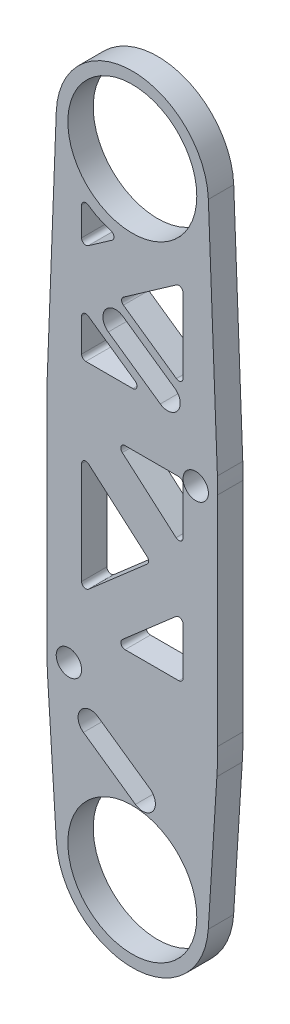
from build123d import *

# Parameters (mm, degrees)
SKETCH1_R               = 7.95
SKETCH1_R_2             = 3
MAIN_BODY_LINK_B1_DEPTH = 6
CUT_EXTRUDE2_REACH      = 169.025
CUT_EXTRUDE3_REACH      = 169.025
SKETCH5_R               = 1.5
PULLEYIDLERUP_DEPTH     = 6
CUT_EXTRUDE5_DEPTH      = 6
FILLET4_R               = 1
FILLET5_R               = 100
SKETCH8_R               = 15.25
CUT_EXTRUDE6_DEPTH      = 168.02546447


with BuildPart() as part:
    # Sketch1 → Main Body Link B1 (new body)
    with BuildSketch(Plane.XY):
        with BuildLine():
            Line((20.2, 41.674052381), (20.2, 83.474052381))
            Line((20.2, 83.474052381), (20.2, 90.874052381))
            Line((20.2, 90.874052381), (17.986683974, 148.383116621))
            ThreePointArc((17.986683974, 148.383116621), (0, 165.690874165), (-17.986683974, 148.383116621))
            Line((-17.986683974, 148.383116621), (-20.2, 90.874052381))
            Line((-20.2, 90.874052381), (-20.2, 83.474052381))
            Line((-20.2, 83.474052381), (-20.2, 41.674052381))
            Line((-20.2, 41.674052381), (-20.2, 34.274052381))
            Line((-20.2, 34.274052381), (-17.964224051, -1.134307826))
            ThreePointArc((-17.964224051, -1.134307826), (0, -18), (17.964224051, -1.134307826))
            Line((17.964224051, -1.134307826), (20.2, 34.274052381))
            Line((20.2, 34.274052381), (20.2, 41.674052381))
        make_face()
        Circle(SKETCH1_R, mode=Mode.SUBTRACT)
        with Locations((15, 88.174052381)):
            Circle(SKETCH1_R_2, mode=Mode.SUBTRACT)
        with Locations((-15, 37.024052381)):
            Circle(SKETCH1_R_2, mode=Mode.SUBTRACT)
        with Locations((0, 147.690874165)):
            Circle(SKETCH1_R, mode=Mode.SUBTRACT)
    extrude(amount=MAIN_BODY_LINK_B1_DEPTH)

    # Sketch4 → Cut-Extrude2 (cut, up to next)
    with BuildSketch(Plane.XY.offset(6), mode=Mode.PRIVATE) as cut_extrude2_sk1:
        with BuildLine():
            Line((-12, 134.2744663), (-12, 123.584968066))
            Line((-12, 123.584968066), (-2.929911079, 129.930929878))
            ThreePointArc((-2.929911079, 129.930929878), (-7.774454217, 131.456408925), (-12, 134.2744663))
        make_face()
    cut_extrude2_tool1 = extrude(cut_extrude2_sk1.sketch, amount=-CUT_EXTRUDE2_REACH, mode=Mode.PRIVATE) & part.part
    # Sketch4 → Cut-Extrude2 (cut, up to next)
    with BuildSketch(Plane.XY.offset(6), mode=Mode.PRIVATE) as cut_extrude2_sk2:
        Polygon((-12, 100.690874165), (3.278172542, 100.690874165), (-12, 111.380372399), align=None)
    cut_extrude2_tool2 = extrude(cut_extrude2_sk2.sketch, amount=-CUT_EXTRUDE2_REACH, mode=Mode.PRIVATE) & part.part
    # Sketch4 → Cut-Extrude2 (cut, up to next)
    with BuildSketch(Plane.XY.offset(6), mode=Mode.PRIVATE) as cut_extrude2_sk3:
        Polygon((12, 128.172168466), (12, 106.793171999), (-3.278172542, 117.482670232), align=None)
    cut_extrude2_tool3 = extrude(cut_extrude2_sk3.sketch, amount=-CUT_EXTRUDE2_REACH, mode=Mode.PRIVATE) & part.part
    # Sketch4 → Cut-Extrude2 (cut, up to next)
    with BuildSketch(Plane.XY.offset(6), mode=Mode.PRIVATE) as cut_extrude2_sk4:
        Polygon((-4.386441158, 88.090874165), (12, 88.090874165), (12, 73.82101499), align=None)
    cut_extrude2_tool4 = extrude(cut_extrude2_sk4.sketch, amount=-CUT_EXTRUDE2_REACH, mode=Mode.PRIVATE) & part.part
    # Sketch4 → Cut-Extrude2 (cut, up to next)
    with BuildSketch(Plane.XY.offset(6), mode=Mode.PRIVATE) as cut_extrude2_sk5:
        Polygon((-12, 81.46073334), (-12, 52.92101499), (4.386441158, 67.190874165), align=None)
    cut_extrude2_tool5 = extrude(cut_extrude2_sk5.sketch, amount=-CUT_EXTRUDE2_REACH, mode=Mode.PRIVATE) & part.part
    # Sketch4 → Cut-Extrude2 (cut, up to next)
    with BuildSketch(Plane.XY.offset(6), mode=Mode.PRIVATE) as cut_extrude2_sk6:
        Polygon((-4.386441158, 46.290874165), (12, 46.290874165), (12, 60.56073334), align=None)
    cut_extrude2_tool6 = extrude(cut_extrude2_sk6.sketch, amount=-CUT_EXTRUDE2_REACH, mode=Mode.PRIVATE) & part.part
    add(cut_extrude2_tool1.solids().sort_by_distance((-9.12997, 128.978342, 6))[0], mode=Mode.SUBTRACT)
    add(cut_extrude2_tool2.solids().sort_by_distance((-6.907276, 104.25404, 6))[0], mode=Mode.SUBTRACT)
    add(cut_extrude2_tool3.solids().sort_by_distance((6.907276, 117.48267, 6))[0], mode=Mode.SUBTRACT)
    add(cut_extrude2_tool4.solids().sort_by_distance((6.537853, 83.334254, 6))[0], mode=Mode.SUBTRACT)
    add(cut_extrude2_tool5.solids().sort_by_distance((-6.537853, 67.190874, 6))[0], mode=Mode.SUBTRACT)
    add(cut_extrude2_tool6.solids().sort_by_distance((6.537853, 51.047494, 6))[0], mode=Mode.SUBTRACT)

    # Sketch5 → Cut-Extrude3 (cut, up to next)
    with BuildSketch(Plane.XY.offset(6), mode=Mode.PRIVATE) as cut_extrude3_sk1:
        with Locations((11.5, 147.690874165)):
            Circle(SKETCH5_R)
    cut_extrude3_tool1 = extrude(cut_extrude3_sk1.sketch, amount=-CUT_EXTRUDE3_REACH, mode=Mode.PRIVATE) & part.part
    # Sketch5 → Cut-Extrude3 (cut, up to next)
    with BuildSketch(Plane.XY.offset(6), mode=Mode.PRIVATE) as cut_extrude3_sk2:
        with Locations((-11.5, 147.690874165)):
            Circle(SKETCH5_R)
    cut_extrude3_tool2 = extrude(cut_extrude3_sk2.sketch, amount=-CUT_EXTRUDE3_REACH, mode=Mode.PRIVATE) & part.part
    # Sketch5 → Cut-Extrude3 (cut, up to next)
    with BuildSketch(Plane.XY.offset(6), mode=Mode.PRIVATE) as cut_extrude3_sk3:
        with Locations((-11.5, 0)):
            Circle(SKETCH5_R)
    cut_extrude3_tool3 = extrude(cut_extrude3_sk3.sketch, amount=-CUT_EXTRUDE3_REACH, mode=Mode.PRIVATE) & part.part
    # Sketch5 → Cut-Extrude3 (cut, up to next)
    with BuildSketch(Plane.XY.offset(6), mode=Mode.PRIVATE) as cut_extrude3_sk4:
        with Locations((11.5, 0)):
            Circle(SKETCH5_R)
    cut_extrude3_tool4 = extrude(cut_extrude3_sk4.sketch, amount=-CUT_EXTRUDE3_REACH, mode=Mode.PRIVATE) & part.part
    add(cut_extrude3_tool1.solids().sort_by_distance((11.5, 147.690874, 6))[0], mode=Mode.SUBTRACT)
    add(cut_extrude3_tool2.solids().sort_by_distance((-11.5, 147.690874, 6))[0], mode=Mode.SUBTRACT)
    add(cut_extrude3_tool3.solids().sort_by_distance((-11.5, 0, 6))[0], mode=Mode.SUBTRACT)
    add(cut_extrude3_tool4.solids().sort_by_distance((11.5, 0, 6))[0], mode=Mode.SUBTRACT)

    # Sketch6 → PulleyIdlerUp (cut)
    with BuildSketch(Plane.XY.offset(6)):
        with BuildLine():
            Line((-5.672455467, 109.394173307), (6.61799676, 100.795058))
            ThreePointArc((6.61799676, 100.795058), (10.795910267, 101.533325384), (10.057642883, 105.71123889))
            Line((10.057642883, 105.71123889), (-2.232809344, 114.310354197))
            ThreePointArc((-2.232809344, 114.310354197), (-6.410722851, 113.572086814), (-5.672455467, 109.394173307))
        make_face()
    extrude(amount=-PULLEYIDLERUP_DEPTH, mode=Mode.SUBTRACT)

    # Sketch7 → Cut-Extrude5 (cut)
    with BuildSketch(Plane.XY.offset(6)):
        with BuildLine():
            Line((-11.550553841, 24.425461103), (0.736726824, 15.821814558))
            ThreePointArc((0.736726824, 15.821814558), (4.914912266, 16.558541382), (4.178185442, 20.736726824))
            Line((4.178185442, 20.736726824), (-8.109095222, 29.340373369))
            ThreePointArc((-8.109095222, 29.340373369), (-12.287280664, 28.603646545), (-11.550553841, 24.425461103))
        make_face()
    extrude(amount=-CUT_EXTRUDE5_DEPTH, mode=Mode.SUBTRACT)

    # Fillet4
    fillet4_edges = [part.edges().sort_by_distance(p)[0] for p in [
        (-12, 81.46073334, 3),
        (4.386441158, 67.190874165, 3),
        (-12, 52.92101499, 3),
        (-12, 134.2744663, 3),
        (-2.929911079, 129.930929878, 3),
        (-12, 123.584968066, 3),
        (-12, 100.690874165, 3),
        (-12, 111.380372399, 3),
        (3.278172542, 100.690874165, 3),
        (12, 106.793171999, 3),
        (-3.278172542, 117.482670232, 3),
        (12, 128.172168466, 3),
        (12, 60.56073334, 3),
        (12, 46.290874165, 3),
        (-4.386441158, 46.290874165, 3),
        (12, 88.090874165, 3),
        (12, 73.82101499, 3),
        (-4.386441158, 88.090874165, 3),
    ]]
    fillet(fillet4_edges, radius=FILLET4_R)

    # Fillet5
    # the kernel refuses this fillet: 100 mm, written as the material it takes off along each edge
    with BuildSketch(Plane(origin=(-20.2, 34.274052381, -7.884973578), x_dir=(0, 1, 0), z_dir=(0, 0, 1))) as fillet5_piece_1:
        with BuildLine():
            CenterArc((FILLET5_R * 0.0315398943126, -FILLET5_R), FILLET5_R, 90, 3.613007947)
            Line((-FILLET5_R * 0.0314772071099, -FILLET5_R * 0.00198755271875), (0, 0))
            Line((0, 0), (FILLET5_R * 0.0315398943126, 0))
        make_face()
    extrude(amount=21.769947156, mode=Mode.SUBTRACT)
    with BuildSketch(Plane(origin=(-20.2, 90.874052381, -4.809018086), x_dir=(0.03845791424359976, 0.9992602207793684, 0), z_dir=(0, 0, 1))) as fillet5_piece_2:
        with BuildLine():
            CenterArc((FILLET5_R * 0.0192360723451, -FILLET5_R), FILLET5_R, 90, 2.204019698)
            Line((-FILLET5_R * 0.0192218418985, -FILLET5_R * 0.000739779220632), (0, 0))
            Line((0, 0), (FILLET5_R * 0.0192360723451, 0))
        make_face()
    extrude(amount=15.618036173, mode=Mode.SUBTRACT)
    with BuildSketch(Plane(origin=(20.2, 90.874052381, -4.809018086), x_dir=(-0.03845791424359111, 0.9992602207793686, 0), z_dir=(0, 0, 1))) as fillet5_piece_3:
        with BuildLine():
            CenterArc((FILLET5_R * 0.0192360723451, FILLET5_R), FILLET5_R, 267.795980302, 2.204019698)
            Line((-FILLET5_R * 0.0192218418985, FILLET5_R * 0.000739779220631), (0, 0))
            Line((0, 0), (FILLET5_R * 0.0192360723451, 0))
        make_face()
    extrude(amount=15.618036173, mode=Mode.SUBTRACT)
    with BuildSketch(Plane(origin=(20.2, 34.274052381, -7.884973578), x_dir=(0, 1, 0), z_dir=(0, 0, 1))) as fillet5_piece_4:
        with BuildLine():
            CenterArc((FILLET5_R * 0.0315398943126, FILLET5_R), FILLET5_R, 266.386992053, 3.613007947)
            Line((-FILLET5_R * 0.0314772071099, FILLET5_R * 0.00198755271875), (0, 0))
            Line((0, 0), (FILLET5_R * 0.0315398943126, 0))
        make_face()
    extrude(amount=21.769947156, mode=Mode.SUBTRACT)

    # Sketch8 → Cut-Extrude6 (cut, through all)
    with BuildSketch(Plane.XY.offset(6)):
        Circle(SKETCH8_R)
        with Locations((0, 147.690874165)):
            Circle(SKETCH8_R)
    extrude(amount=-CUT_EXTRUDE6_DEPTH, mode=Mode.SUBTRACT)


solid = part.part
